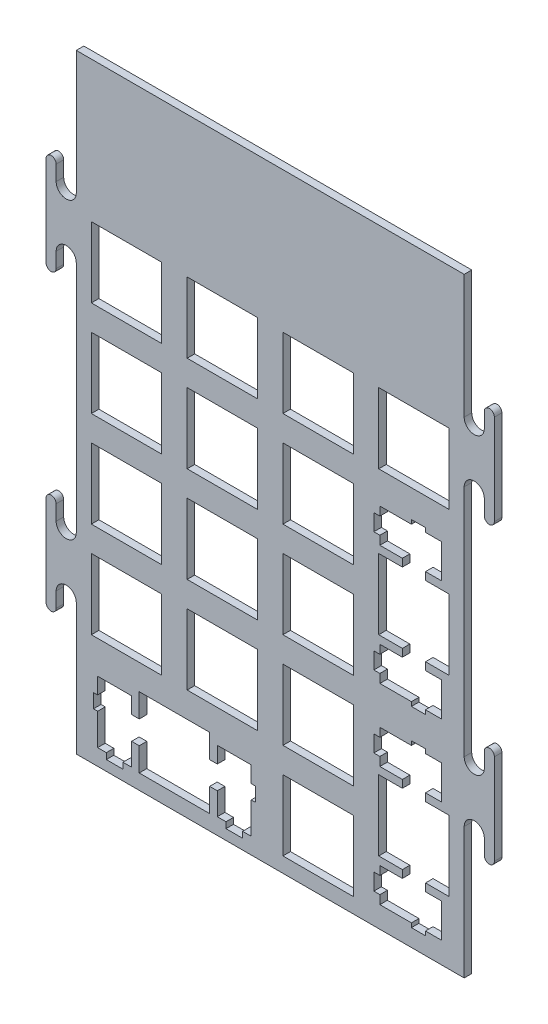
from build123d import *

# Parameters (mm, degrees)
MODEL_W         = 13.99955
MODEL_H         = 13.9994
MODEL_W_2       = 13.9993
MODEL_H_2       = 13.9993
MODEL_H_3       = 13.99946
EXTRUDE_1_DEPTH = 1.5


with BuildPart() as part:
    # Model → 凸台-拉伸1 (new body)
    with BuildSketch(Plane.XY):
        with BuildLine():
            Line((102.160177429, 23.884872236), (102.160177429, -2.214857764))
            Line((102.160177429, -2.214857764), (179.309527429, -2.214857764))
            Line((179.309527429, -2.214857764), (179.309527429, 23.884872236))
            ThreePointArc((179.309527429, 23.884872236), (179.895313866, 25.299085798), (181.309527429, 25.884872236))
            ThreePointArc((181.309527429, 25.884872236), (182.723740991, 25.299085798), (183.309527429, 23.884872236))
            Line((183.309527429, 23.884872236), (183.309527429, 20.884872236))
            ThreePointArc((183.309527429, 20.884872236), (183.602420647, 20.177765455), (184.309527429, 19.884872236))
            ThreePointArc((184.309527429, 19.884872236), (185.01663421, 20.177765455), (185.309527429, 20.884872236))
            Line((185.309527429, 20.884872236), (185.309527429, 38.884872236))
            ThreePointArc((185.309527429, 38.884872236), (185.01663421, 39.591979017), (184.309527429, 39.884872236))
            ThreePointArc((184.309527429, 39.884872236), (183.602420647, 39.591979017), (183.309527429, 38.884872236))
            Line((183.309527429, 38.884872236), (183.309527429, 35.884872236))
            ThreePointArc((183.309527429, 35.884872236), (182.723740991, 34.470658673), (181.309527429, 33.884872236))
            ThreePointArc((181.309527429, 33.884872236), (179.895313866, 34.470658673), (179.309527429, 35.884872236))
            Line((179.309527429, 35.884872236), (179.309527429, 82.384872236))
            ThreePointArc((179.309527429, 82.384872236), (179.895313866, 83.799085798), (181.309527429, 84.384872236))
            ThreePointArc((181.309527429, 84.384872236), (182.723740991, 83.799085798), (183.309527429, 82.384872236))
            Line((183.309527429, 82.384872236), (183.309527429, 79.384872236))
            ThreePointArc((183.309527429, 79.384872236), (183.602420647, 78.677765455), (184.309527429, 78.384872236))
            ThreePointArc((184.309527429, 78.384872236), (185.01663421, 78.677765455), (185.309527429, 79.384872236))
            Line((185.309527429, 79.384872236), (185.309527429, 97.384872236))
            ThreePointArc((185.309527429, 97.384872236), (185.01663421, 98.091979017), (184.309527429, 98.384872236))
            ThreePointArc((184.309527429, 98.384872236), (183.602420647, 98.091979017), (183.309527429, 97.384872236))
            Line((183.309527429, 97.384872236), (183.309527429, 94.384872236))
            ThreePointArc((183.309527429, 94.384872236), (182.723740991, 92.970658673), (181.309527429, 92.384872236))
            ThreePointArc((181.309527429, 92.384872236), (179.895313866, 92.970658673), (179.309527429, 94.384872236))
            Line((179.309527429, 94.384872236), (179.309527429, 118.984602236))
            Line((179.309527429, 118.984602236), (102.160177429, 118.984602236))
            Line((102.160177429, 118.984602236), (102.160177429, 94.384872236))
            ThreePointArc((102.160177429, 94.384872236), (101.574390991, 92.970658673), (100.160177429, 92.384872236))
            ThreePointArc((100.160177429, 92.384872236), (98.745963866, 92.970658673), (98.160177429, 94.384872236))
            Line((98.160177429, 94.384872236), (98.160177429, 97.384872236))
            ThreePointArc((98.160177429, 97.384872236), (97.86728421, 98.091979017), (97.160177429, 98.384872236))
            ThreePointArc((97.160177429, 98.384872236), (96.453070647, 98.091979017), (96.160177429, 97.384872236))
            Line((96.160177429, 97.384872236), (96.160177429, 79.384872236))
            ThreePointArc((96.160177429, 79.384872236), (96.453070647, 78.677765455), (97.160177429, 78.384872236))
            ThreePointArc((97.160177429, 78.384872236), (97.86728421, 78.677765455), (98.160177429, 79.384872236))
            Line((98.160177429, 79.384872236), (98.160177429, 82.384872236))
            ThreePointArc((98.160177429, 82.384872236), (98.745963866, 83.799085798), (100.160177429, 84.384872236))
            ThreePointArc((100.160177429, 84.384872236), (101.574390991, 83.799085798), (102.160177429, 82.384872236))
            Line((102.160177429, 82.384872236), (102.160177429, 35.884872236))
            ThreePointArc((102.160177429, 35.884872236), (101.574390991, 34.470658673), (100.160177429, 33.884872236))
            ThreePointArc((100.160177429, 33.884872236), (98.745963866, 34.470658673), (98.160177429, 35.884872236))
            Line((98.160177429, 35.884872236), (98.160177429, 38.884872236))
            ThreePointArc((98.160177429, 38.884872236), (97.86728421, 39.591979017), (97.160177429, 39.884872236))
            ThreePointArc((97.160177429, 39.884872236), (96.453070647, 39.591979017), (96.160177429, 38.884872236))
            Line((96.160177429, 38.884872236), (96.160177429, 20.884872236))
            ThreePointArc((96.160177429, 20.884872236), (96.453070647, 20.177765455), (97.160177429, 19.884872236))
            ThreePointArc((97.160177429, 19.884872236), (97.86728421, 20.177765455), (98.160177429, 20.884872236))
            Line((98.160177429, 20.884872236), (98.160177429, 23.884872236))
            ThreePointArc((98.160177429, 23.884872236), (98.745963866, 25.299085798), (100.160177429, 25.884872236))
            ThreePointArc((100.160177429, 25.884872236), (101.574390991, 25.299085798), (102.160177429, 23.884872236))
        make_face()
        with Locations((112.159952429, 26.834802236)):
            Rectangle(MODEL_W, MODEL_H, mode=Mode.SUBTRACT)
        Polygon((114.685227429, 10.084102236), (114.685227429, 14.784602236), (128.684627429, 14.784602236), (128.684627429, 10.084102236), (130.210127429, 10.084102236), (130.210127429, 13.314302236), (136.959827429, 13.314302236), (136.959827429, 10.084102236), (137.785227429, 10.084102236), (137.785227429, 7.285342236), (136.959827429, 7.285342236), (136.959827429, 1.015272236), (135.234527429, 1.015272236), (135.234527429, -0.184997764), (131.935427429, -0.184997764), (131.935427429, 1.015272236), (130.210127429, 1.015272236), (130.210127429, 5.484232236), (128.684627429, 5.484232236), (128.684627429, 0.785142236), (114.685227429, 0.785142236), (114.685227429, 5.484232236), (113.159727429, 5.484232236), (113.159727429, 1.015272236), (111.434377429, 1.015272236), (111.434377429, -0.184997764), (108.135367429, -0.184997764), (108.135367429, 1.015272236), (106.410077429, 1.015272236), (106.410077429, 7.285342236), (105.584617429, 7.285342236), (105.584617429, 10.084102236), (106.410077429, 10.084102236), (106.410077429, 13.314302236), (113.159727429, 13.314302236), (113.159727429, 10.084102236), align=None, mode=Mode.SUBTRACT)
        with Locations((131.209877429, 26.834802236)):
            Rectangle(MODEL_W_2, MODEL_H, mode=Mode.SUBTRACT)
        with Locations((112.159952429, 45.884952236)):
            Rectangle(MODEL_W, MODEL_H_2, mode=Mode.SUBTRACT)
        with Locations((131.209877429, 45.884952236)):
            Rectangle(MODEL_W_2, MODEL_H_2, mode=Mode.SUBTRACT)
        with Locations((150.259877429, 7.784872236)):
            Rectangle(MODEL_W_2, MODEL_H_3, mode=Mode.SUBTRACT)
        with Locations((150.259877429, 26.834802236)):
            Rectangle(MODEL_W_2, MODEL_H, mode=Mode.SUBTRACT)
        Polygon((168.810527429, 32.584802236), (168.810527429, 33.410202236), (171.610527429, 33.410202236), (171.610527429, 32.584802236), (174.840527429, 32.584802236), (174.840527429, 25.835102236), (171.610527429, 25.835102236), (171.610527429, 24.309602236), (176.309527429, 24.309602236), (176.309527429, 10.310102236), (171.610527429, 10.310102236), (171.610527429, 8.784602236), (174.840527429, 8.784602236), (174.840527429, 2.035022236), (171.610527429, 2.035022236), (171.610527429, 1.209572236), (168.810527429, 1.209572236), (168.810527429, 2.035022236), (162.540227429, 2.035022236), (162.540227429, 3.760312236), (161.340127429, 3.760312236), (161.340127429, 7.059352236), (162.540227429, 7.059352236), (162.540227429, 8.784602236), (167.010627429, 8.784602236), (167.010627429, 10.310102236), (162.310227429, 10.310102236), (162.310227429, 24.309602236), (167.010627429, 24.309602236), (167.010627429, 25.835102236), (162.540227429, 25.835102236), (162.540227429, 27.560402236), (161.340127429, 27.560402236), (161.340127429, 30.859402236), (162.540227429, 30.859402236), (162.540227429, 32.584802236), align=None, mode=Mode.SUBTRACT)
        with Locations((150.259877429, 45.884952236)):
            Rectangle(MODEL_W_2, MODEL_H_2, mode=Mode.SUBTRACT)
        Polygon((168.810527429, 70.684702236), (168.810527429, 71.510202236), (171.610527429, 71.510202236), (171.610527429, 70.684702236), (174.840527429, 70.684702236), (174.840527429, 63.935002236), (171.610527429, 63.935002236), (171.610527429, 62.409602236), (176.309527429, 62.409602236), (176.309527429, 48.410302236), (171.610527429, 48.410302236), (171.610527429, 46.884502236), (174.840527429, 46.884502236), (174.840527429, 40.135202236), (171.610527429, 40.135202236), (171.610527429, 39.309702236), (168.810527429, 39.309702236), (168.810527429, 40.135202236), (162.540227429, 40.135202236), (162.540227429, 41.860202236), (161.340127429, 41.860202236), (161.340127429, 45.159402236), (162.540227429, 45.159402236), (162.540227429, 46.884502236), (167.010627429, 46.884502236), (167.010627429, 48.410302236), (162.310227429, 48.410302236), (162.310227429, 62.409602236), (167.010627429, 62.409602236), (167.010627429, 63.935002236), (162.540227429, 63.935002236), (162.540227429, 65.660402236), (161.340127429, 65.660402236), (161.340127429, 68.959602236), (162.540227429, 68.959602236), (162.540227429, 70.684702236), align=None, mode=Mode.SUBTRACT)
        with Locations((112.159952429, 64.934952236)):
            Rectangle(MODEL_W, MODEL_H_2, mode=Mode.SUBTRACT)
        with Locations((112.159952429, 83.984952236)):
            Rectangle(MODEL_W, MODEL_H_2, mode=Mode.SUBTRACT)
        with Locations((131.209877429, 64.934952236)):
            Rectangle(MODEL_W_2, MODEL_H_2, mode=Mode.SUBTRACT)
        with Locations((131.209877429, 83.984952236)):
            Rectangle(MODEL_W_2, MODEL_H_2, mode=Mode.SUBTRACT)
        with Locations((150.259877429, 64.934952236)):
            Rectangle(MODEL_W_2, MODEL_H_2, mode=Mode.SUBTRACT)
        with Locations((150.259877429, 83.984952236)):
            Rectangle(MODEL_W_2, MODEL_H_2, mode=Mode.SUBTRACT)
        with Locations((169.309877429, 83.984952236)):
            Rectangle(MODEL_W_2, MODEL_H_2, mode=Mode.SUBTRACT)
    extrude(amount=EXTRUDE_1_DEPTH)


solid = part.part
